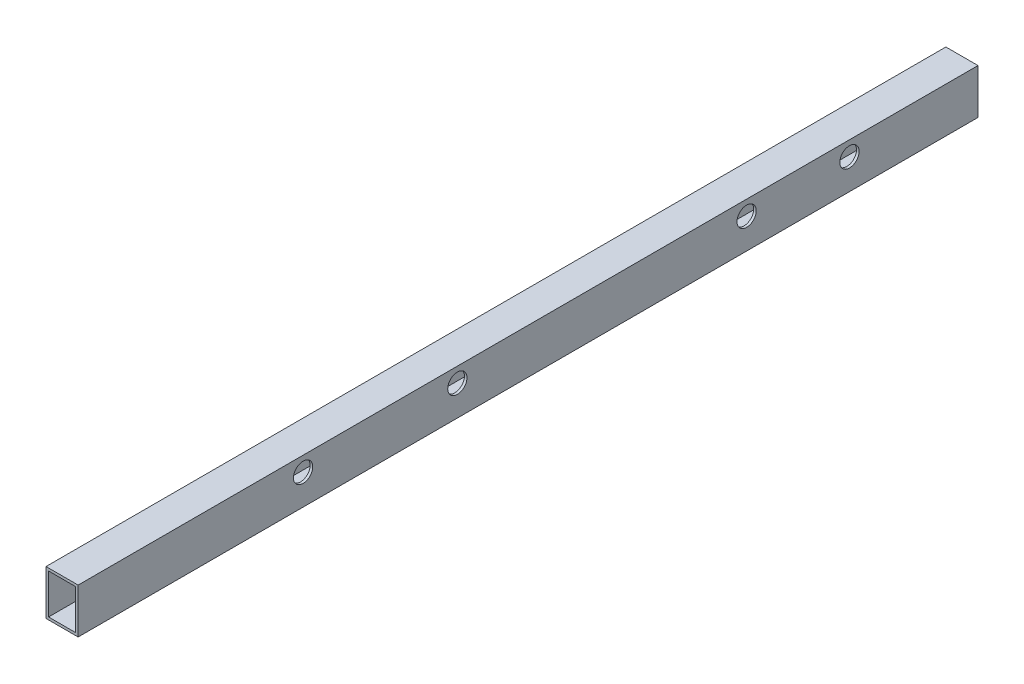
from build123d import *

# Parameters (mm, degrees)
SKETCH1_W           = 50
SKETCH1_H           = 70
SKETCH1_W_2         = 42
SKETCH1_H_2         = 62
BOSS_EXTRUDE2_DEPTH = 1400
SKETCH2_R           = 15
CUT_EXTRUDE1_DEPTH  = 1403.640367307


with BuildPart() as part:
    # Sketch1 → Boss-Extrude2 (new body)
    with BuildSketch(Plane.XY):
        with Locations((25, -35)):
            Rectangle(SKETCH1_W, SKETCH1_H)
        with Locations((25, -35)):
            Rectangle(SKETCH1_W_2, SKETCH1_H_2, mode=Mode.SUBTRACT)
    extrude(amount=BOSS_EXTRUDE2_DEPTH)

    # Sketch2 → Cut-Extrude1 (cut, through all)
    with BuildSketch(Plane(origin=(50, 0, 0), x_dir=(0, 0, -1), z_dir=(1, 0, 0))):
        with Locations((-1050, -23)):
            Circle(SKETCH2_R)
        with Locations((-200, -23)):
            Circle(SKETCH2_R)
        with Locations((-810, -23)):
            Circle(SKETCH2_R)
        with Locations((-360, -23)):
            Circle(SKETCH2_R)
    extrude(amount=-CUT_EXTRUDE1_DEPTH, mode=Mode.SUBTRACT)


solid = part.part
